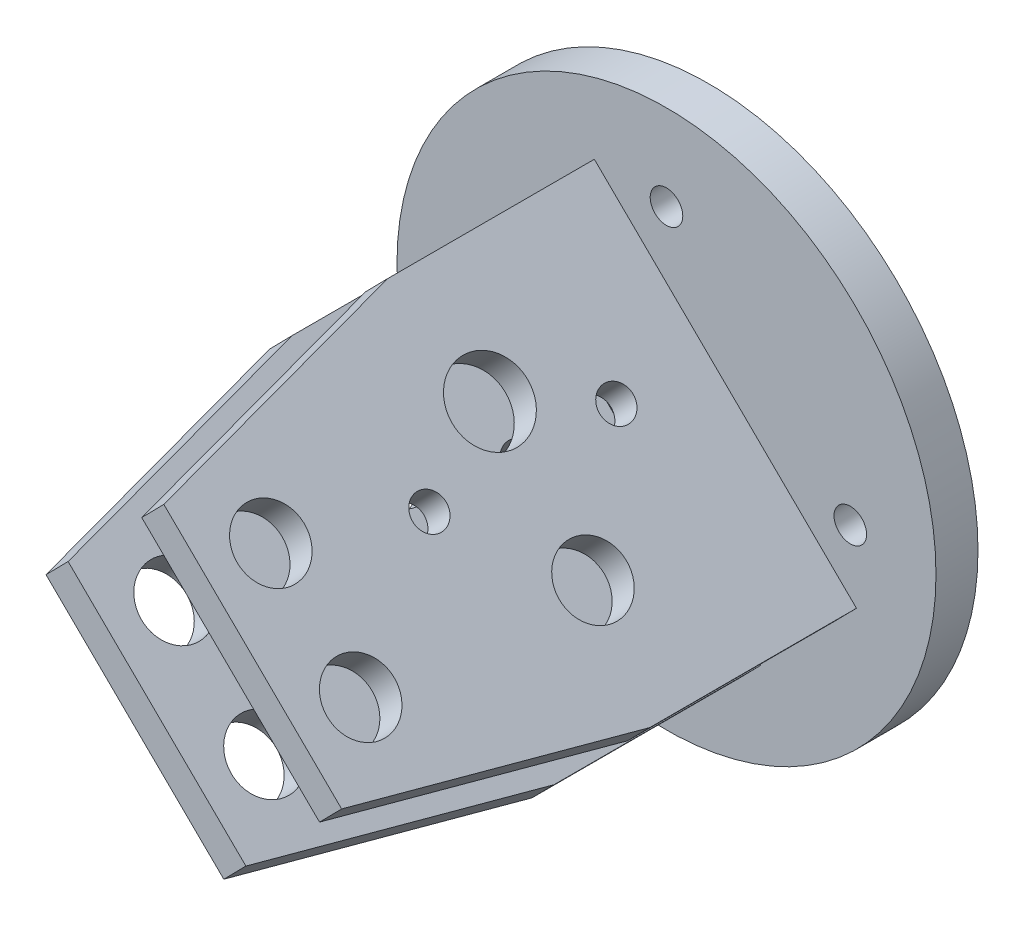
from build123d import *

# Parameters (mm, degrees)
SKETCH1_R               = 32.585342618
SKETCH1_R_2             = 1.9685
BOSS_EXTRUDE1_DEPTH     = 5.08
BOSS_EXTRUDE2_DEPTH     = 57.15
SKETCH3_R               = 2.032
CUT_EXTRUDE1_DEPTH      = 57.15
CUT_EXTRUDE2_DEPTH      = 84.879522762
CUT_EXTRUDE2_DEPTH_BACK = 84.879522762
SKETCH4_R               = 4.572
CUT_EXTRUDE3_DEPTH      = 84.879522762
CUT_EXTRUDE3_DEPTH_BACK = 84.879522762
SKETCH5_R               = 4.064


with BuildPart() as part:
    # Sketch1 → Boss-Extrude1 (new body)
    with BuildSketch(Plane.XY):
        Circle(SKETCH1_R)
        with Locations((-22.225, 0)):
            Circle(SKETCH1_R_2, mode=Mode.SUBTRACT)
        with Locations((0, -22.225)):
            Circle(SKETCH1_R_2, mode=Mode.SUBTRACT)
        with Locations((22.225, 0)):
            Circle(SKETCH1_R_2, mode=Mode.SUBTRACT)
        with Locations((0, 22.225)):
            Circle(SKETCH1_R_2, mode=Mode.SUBTRACT)
    extrude(amount=BOSS_EXTRUDE1_DEPTH)

    # Sketch2 → Boss-Extrude2 (add)
    with BuildSketch(Plane.XY.offset(5.08)):
        Polygon((-22.96980806, 8.340512137), (8.721384481, -22.827914441), (11.392963902, -20.111526509), (-20.298228639, 11.056900069), align=None)
        Polygon((-11.392963902, 20.111526509), (20.298228639, -11.056900069), (22.96980806, -8.340512137), (-8.721384481, 22.827914441), align=None)
    extrude(amount=BOSS_EXTRUDE2_DEPTH)

    # Sketch3 → Cut-Extrude1 (cut)
    with BuildSketch(Plane(origin=(-7.124211789, -7.243701152, 0), x_dir=(0.7129627118290454, -0.7012019477592556, 0), z_dir=(-0.7012019477592556, -0.7129627118290454, 0))):
        with Locations((-3.175, 16.002)):
            Circle(SKETCH3_R)
        with Locations((-3.175, 38.608)):
            Circle(SKETCH3_R)
    extrude(amount=-CUT_EXTRUDE1_DEPTH, mode=Mode.SUBTRACT)

    # Sketch4 → Cut-Extrude2 (cut, two sides: drawn at the far end of the back side and taken through both)
    with BuildSketch(Plane(origin=(-7.124211789, -7.243701152, 0), x_dir=(0.7129627118290519, -0.7012019477592487, 0), z_dir=(-0.7012019477592487, -0.7129627118290519, 0)).offset(-CUT_EXTRUDE2_DEPTH_BACK)):
        with Locations((-8.763, 27.305)):
            Circle(SKETCH4_R)
        Polygon((-22.225, 30.066797899), (-15.07657634, 62.23), (-22.225, 62.23), align=None)
        Polygon((22.225, 62.23), (22.225, 30.066797899), (15.07657634, 62.23), align=None)
    extrude(amount=CUT_EXTRUDE2_DEPTH + CUT_EXTRUDE2_DEPTH_BACK, mode=Mode.SUBTRACT)

    # Sketch5 → Cut-Extrude3 (cut, two sides: drawn at the far end of the back side and taken through both)
    with BuildSketch(Plane(origin=(-7.124211789, -7.243701152, 0), x_dir=(0.7129627118290519, -0.7012019477592487, 0), z_dir=(-0.7012019477592487, -0.7129627118290519, 0)).offset(-CUT_EXTRUDE3_DEPTH_BACK)):
        with Locations((7.62, 54.61)):
            Circle(SKETCH5_R)
        with Locations((-7.62, 54.61)):
            Circle(SKETCH5_R)
        with Locations((8.89, 27.432)):
            Circle(SKETCH5_R)
    extrude(amount=CUT_EXTRUDE3_DEPTH + CUT_EXTRUDE3_DEPTH_BACK, mode=Mode.SUBTRACT)


solid = part.part
